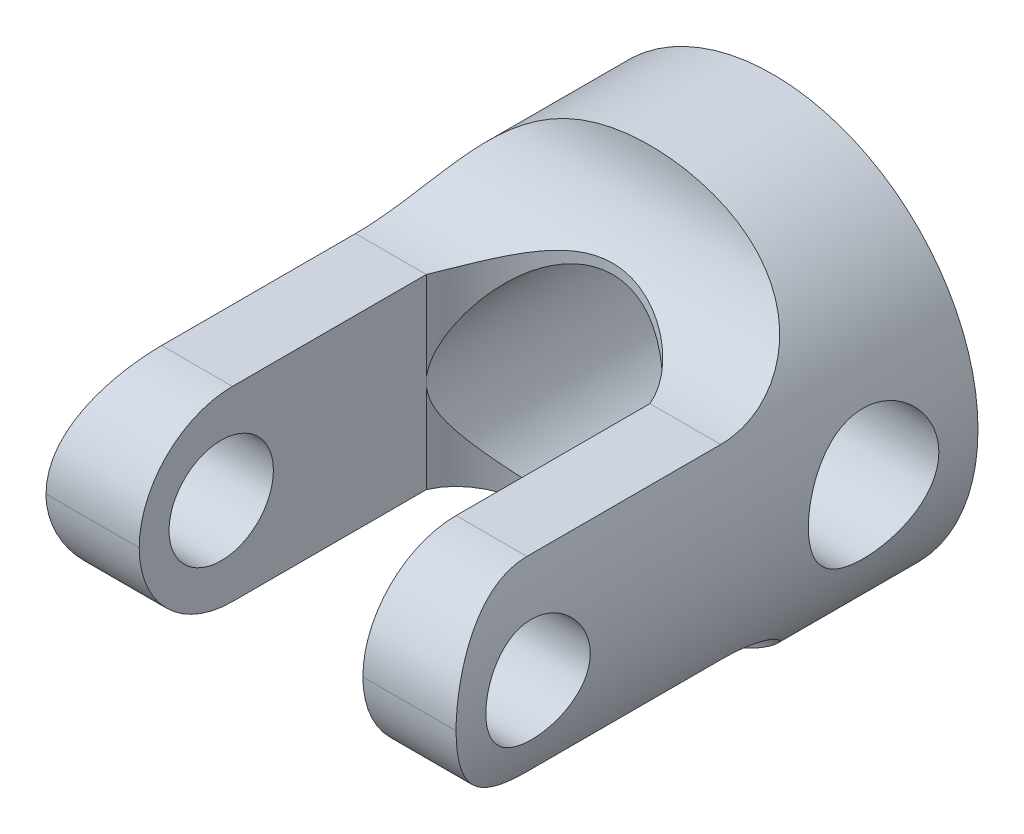
from build123d import *

# Parameters (mm, degrees)
SKETCH_1_R               = 5.5
EXTRUDE_1_DEPTH          = 14
SKETCH_2_R               = 3
CUT_EXTRUDE_1_DEPTH      = 17.015617378
CUT_EXTRUDE_2_DEPTH      = 17.015617378
CUT_EXTRUDE_2_DEPTH_BACK = 17.015617378
CUT_EXTRUDE_3_DEPTH      = 17.015617534
CUT_EXTRUDE_3_DEPTH_BACK = 17.015617534
FILLET_1_R               = 2.5
SKETCH_5_R               = 1.75
CUT_EXTRUDE_4_DEPTH      = 17.015617534
CUT_EXTRUDE_5_DEPTH      = 17.015617534
CUT_EXTRUDE_5_DEPTH_BACK = 17.015617534
SKETCH_6_R               = 1.4


with BuildPart() as part:
    # 草图1 → 凸台-拉伸1 (new body)
    with BuildSketch(Plane.XY):
        Circle(SKETCH_1_R)
    extrude(amount=EXTRUDE_1_DEPTH)

    # 草图2 → 切除-拉伸1 (cut, through all)
    with BuildSketch(Plane(origin=(0, 0, 0), x_dir=(-1, 0, 0), z_dir=(0, 0, -1))):
        Circle(SKETCH_2_R)
    extrude(amount=-CUT_EXTRUDE_1_DEPTH, mode=Mode.SUBTRACT)

    # 草图3 → 切除-拉伸2 (cut, two sides: drawn at the far end of the back side and taken through both)
    with BuildSketch(Plane(origin=(0, 0, 0), x_dir=(1, 0, 0), z_dir=(0, 1, 0)).offset(-CUT_EXTRUDE_2_DEPTH_BACK)):
        with BuildLine():
            Line((-3, -14), (3, -14))
            Line((3, -14), (3, -6.3))
            ThreePointArc((3, -6.3), (0, -4.3), (-3, -6.3))
            Line((-3, -6.3), (-3, -14))
        make_face()
    extrude(amount=CUT_EXTRUDE_2_DEPTH + CUT_EXTRUDE_2_DEPTH_BACK, mode=Mode.SUBTRACT)

    # 草图4 → 切除-拉伸3 (cut, two sides: drawn at the far end of the back side and taken through both)
    with BuildSketch(Plane(origin=(0, 0, 0), x_dir=(0, 0, -1), z_dir=(1, 0, 0)).offset(-CUT_EXTRUDE_3_DEPTH_BACK)):
        with BuildLine():
            Line((-14, 2.5), (-6.3, 2.5))
            ThreePointArc((-6.3, 2.5), (-4.003021048, 3.570262273), (-3.344955373, 6.017408205))
            Line((-3.344955373, 6.017408205), (-3.344955373, 8.923023013))
            Line((-3.344955373, 8.923023013), (-14, 8.923023013))
            Line((-14, 8.923023013), (-14, 2.5))
        make_face()
        with BuildLine():
            Line((-14, -2.5), (-6.3, -2.5))
            ThreePointArc((-6.3, -2.5), (-3.674156249, -4.049157281), (-3.760209141, -7.096703602))
            Line((-3.760209141, -7.096703602), (-6.538750291, -8.043650362))
            Line((-6.538750291, -8.043650362), (-14, -8.043650362))
            Line((-14, -8.043650362), (-14, -2.5))
        make_face()
    extrude(amount=CUT_EXTRUDE_3_DEPTH + CUT_EXTRUDE_3_DEPTH_BACK, mode=Mode.SUBTRACT)

    # 圆角1
    fillet_1_edges = [part.edges().sort_by_distance(p)[0] for p in [
        (-3.949489743, -2.5, 14),
        (-3.949489743, 2.5, 14),
        (3.949489743, 2.5, 14),
        (3.949489743, -2.5, 14),
    ]]
    fillet(fillet_1_edges, radius=FILLET_1_R - 0.0001)  # a hair under: the kernel refuses the full size

    # 草图5 → 切除-拉伸4 (cut, through all)
    with BuildSketch(Plane(origin=(0, 0, 0), x_dir=(0, 0, -1), z_dir=(1, 0, 0))):
        with Locations(Location((-2.8, 0, 0), (0, 0, 180))):
            Circle(SKETCH_5_R)
    extrude(amount=CUT_EXTRUDE_4_DEPTH, mode=Mode.SUBTRACT)

    # 草图6 → 切除-拉伸5 (cut, two sides: drawn at the far end of the back side and taken through both)
    with BuildSketch(Plane(origin=(0, 0, 0), x_dir=(0, 0, -1), z_dir=(1, 0, 0)).offset(-CUT_EXTRUDE_5_DEPTH_BACK)):
        with Locations((-11.8, 0)):
            Circle(SKETCH_6_R)
    extrude(amount=CUT_EXTRUDE_5_DEPTH + CUT_EXTRUDE_5_DEPTH_BACK, mode=Mode.SUBTRACT)


solid = part.part
